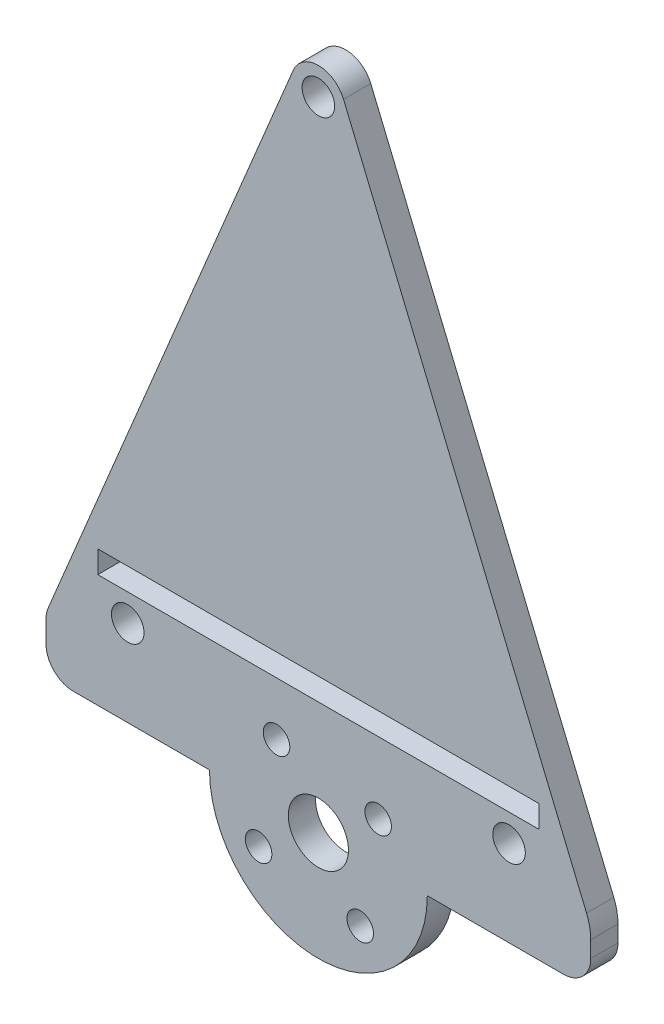
from build123d import *

# Parameters (mm, degrees)
BOSS_EXTRUDE1_DEPTH = 3.175
FILLET4_R           = 3.175
FILLET5_R           = 3.175
FILLET6_R           = 3.175
FILLET7_R           = 6.35
FILLET8_R           = 3.175
SKETCH2_R           = 3.5052
SKETCH2_R_2         = 1.5494
CUT_EXTRUDE1_DEPTH  = 78.949968089
SKETCH4_W           = 51.435
SKETCH4_H           = 2.6035
CUT_EXTRUDE2_DEPTH  = 78.949968089
SKETCH10_R          = 1.89865
CUT_EXTRUDE3_DEPTH  = 78.949968089
SKETCH11_R          = 1.89865
CUT_EXTRUDE4_DEPTH  = 78.949968089


with BuildPart() as part:
    # Sketch1 → Boss-Extrude1 (new body)
    with BuildSketch(Plane.XY):
        with BuildLine():
            Line((-31.75, 0), (-31.75, -6.35))
            Line((-31.75, -6.35), (-12.7, -6.35))
            ThreePointArc((-12.7, -6.35), (0, -19.05), (12.7, -6.35))
            Line((12.7, -6.35), (31.75, -6.35))
            Line((31.75, -6.35), (31.75, 0))
            Line((31.75, 0), (0, 76.2))
            Line((0, 76.2), (-31.75, 0))
        make_face()
    extrude(amount=BOSS_EXTRUDE1_DEPTH)

    # Fillet4
    fillet4_edges = [part.edges().sort_by_distance(p)[0] for p in [
        (-31.75, -6.35, 1.5875),
    ]]
    fillet(fillet4_edges, radius=FILLET4_R)

    # Fillet5
    fillet5_edges = [part.edges().sort_by_distance(p)[0] for p in [
        (-31.75, 0, 1.5875),
    ]]
    fillet(fillet5_edges, radius=FILLET5_R)

    # Fillet6
    fillet6_edges = [part.edges().sort_by_distance(p)[0] for p in [
        (0, 76.2, 1.5875),
    ]]
    fillet(fillet6_edges, radius=FILLET6_R)

    # Fillet7
    fillet7_edges = [part.edges().sort_by_distance(p)[0] for p in [
        (31.75, 0, 1.5875),
    ]]
    fillet(fillet7_edges, radius=FILLET7_R)

    # Fillet8
    fillet8_edges = [part.edges().sort_by_distance(p)[0] for p in [
        (31.75, -6.35, 1.5875),
    ]]
    fillet(fillet8_edges, radius=FILLET8_R)

    # Sketch2 → Cut-Extrude1 (cut, through all)
    with BuildSketch(Plane.XY.offset(3.175)):
        with Locations((0, -6.35)):
            Circle(SKETCH2_R)
        with Locations((-4.880561897, 0.620164745)):
            Circle(SKETCH2_R_2)
        with Locations((4.880561897, -13.320164745)):
            Circle(SKETCH2_R_2)
        with Locations((6.970164745, -1.469438103)):
            Circle(SKETCH2_R_2)
        with Locations((-6.970164745, -11.230561897)):
            Circle(SKETCH2_R_2)
    extrude(amount=-CUT_EXTRUDE1_DEPTH, mode=Mode.SUBTRACT)

    # Sketch4 → Cut-Extrude2 (cut, through all)
    with BuildSketch(Plane.XY.offset(3.175)):
        with Locations((0, 8.154999946)):
            Rectangle(SKETCH4_W, SKETCH4_H)
    extrude(amount=-CUT_EXTRUDE2_DEPTH, mode=Mode.SUBTRACT)

    # Sketch10 → Cut-Extrude3 (cut, through all)
    with BuildSketch(Plane.XY.offset(3.175)):
        with Locations((-22.225, 3.678249946)):
            Circle(SKETCH10_R)
        with Locations((22.225, 3.678249946)):
            Circle(SKETCH10_R)
    extrude(amount=-CUT_EXTRUDE3_DEPTH, mode=Mode.SUBTRACT)

    # Sketch11 → Cut-Extrude4 (cut, through all)
    with BuildSketch(Plane.XY.offset(3.175)):
        with Locations((0, 67.945)):
            Circle(SKETCH11_R)
    extrude(amount=-CUT_EXTRUDE4_DEPTH, mode=Mode.SUBTRACT)


solid = part.part
